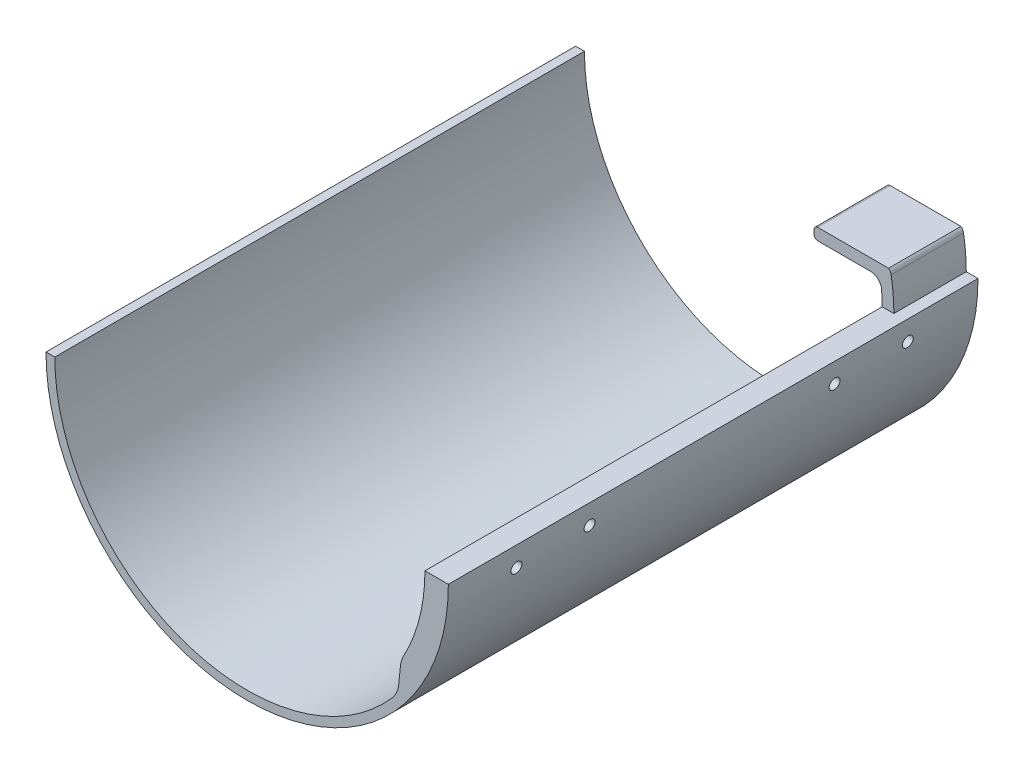
from build123d import *

# Parameters (mm, degrees)
EXTRUDE_1_DEPTH     = 144.8
SKETCH_7_R          = 1.5
CUT_EXTRUDE_6_DEPTH = 80
CUT_EXTRUDE_START   = -125
CUT_EXTRUDE_8_DEPTH = 125


with BuildPart() as part:
    # 草图1 → 凸台-拉伸1 (new body)
    with BuildSketch(Plane.XY):
        with BuildLine():
            Line((-55, 0), (-52.6, 0))
            ThreePointArc((-52.6, 0), (-18.385988634, -49.281998964), (39.74659399, -34.452405812))
            ThreePointArc((39.74659399, -34.452405812), (40.882352545, -32.645331036), (41.420765833, -30.58000349))
            Line((41.420765833, -30.58000349), (41.910264928, -25.795992674))
            ThreePointArc((41.910264928, -25.795992674), (42.185460224, -24.44340265), (42.720717667, -23.171108779))
            ThreePointArc((42.720717667, -23.171108779), (47.564735827, -9.977770578), (48.43095601, 4.05))
            ThreePointArc((48.43095601, 4.05), (47.472400425, 6.007940217), (45.441390824, 6.8))
            Line((45.441390824, 6.8), (31, 6.8))
            ThreePointArc((31, 6.8), (30.292893219, 7.092893219), (30, 7.8))
            Line((30, 7.8), (30, 9))
            ThreePointArc((30, 9), (30.292893219, 9.707106781), (31, 10))
            Line((31, 10), (50.344019583, 10))
            ThreePointArc((50.344019583, 10), (50.805346897, 9.459374484), (51.0484918, 8.791557597))
            ThreePointArc((51.0484918, 8.791557597), (51.611780996, 4.411809423), (51.8, 0))
            Line((51.8, 0), (55, 0))
            ThreePointArc((55, 0), (0, -55), (-55, 0))
        make_face()
    extrude(amount=EXTRUDE_1_DEPTH)

    # 草图7 → 切除-拉伸6 (cut)
    with BuildSketch(Plane(origin=(0, 0, 0), x_dir=(0.10066073352284005, 0.994920809274107, 0), z_dir=(-0.9949208092741069, 0.10066073352284004, 0))):
        with Locations((-0.136340344, -18.9)):
            Circle(SKETCH_7_R)
        with Locations((-0.136340344, -38.9)):
            Circle(SKETCH_7_R)
        with Locations((-0.136340344, -105.9)):
            Circle(SKETCH_7_R)
        with Locations((-0.136340344, -125.9)):
            Circle(SKETCH_7_R)
    extrude(amount=-CUT_EXTRUDE_6_DEPTH, mode=Mode.SUBTRACT)

    # 草图4 → 切除-拉伸8 (cut)
    with BuildSketch(Plane.XY.offset(144.8).offset(CUT_EXTRUDE_START)):
        with BuildLine():
            Line((55, 0), (0, 0))
            Line((0, 0), (50.016978469, 22.875792113))
            ThreePointArc((50.016978469, 22.875792113), (53.739807479, 11.70611345), (55, 0))
        make_face()
    extrude(amount=CUT_EXTRUDE_8_DEPTH, mode=Mode.SUBTRACT)


solid = part.part
